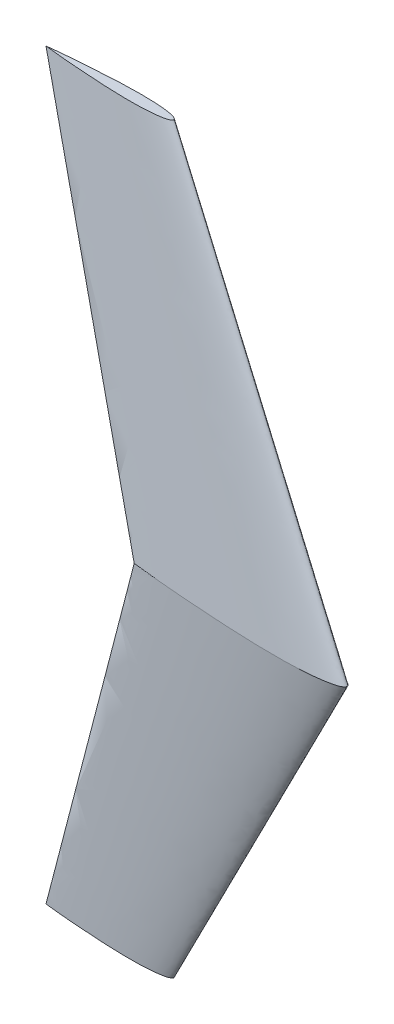
from build123d import *


with BuildPart() as part:
    # Loft1: read off the stored shape, not the designer's step
    # Loft1: loft between two sections, ruled curve by curve
    loft1_from = [
        Edge.make_bspline([(-9121.721523, 10153.4, -888.3073962), (-9121.721523, 10153.4, -888.97481667), (-9089.808343706, 10153.4, -891.630247371), (-9057.07807669, 10153.4, -897.171405393), (-8977.573882293, 10153.4, -905.666450739), (-8879.891657699, 10153.4, -916.211213285), (-8752.61238274, 10153.4, -928.585402678), (-8603.179510828, 10153.4, -942.241130984), (-8432.246847932, 10153.4, -956.914696759), (-8243.391266019, 10153.4, -972.176720475), (-8039.623752093, 10153.4, -987.41758735), (-7824.497301325, 10153.4, -1002.185700126), (-7601.67730037, 10153.4, -1015.801504829), (-7374.97893646, 10153.4, -1027.688394313), (-7148.272960999, 10153.4, -1037.139757469), (-6961.081058327, 10153.4, -1042.599652216), (-6814.239664316, 10153.4, -1045.107889524), (-6707.412896579, 10153.4, -1045.99805137), (-6603.437102019, 10153.4, -1045.873706629), (-6502.756991249, 10153.4, -1044.535259245), (-6405.811536, 10153.4, -1042.185839499), (-6313.023888406, 10153.4, -1038.637706974), (-6224.784017274, 10153.4, -1034.020057375), (-6141.458107161, 10153.4, -1028.225249142), (-6063.399479883, 10153.4, -1021.351335422), (-5990.967621691, 10153.4, -1013.338130748), (-5924.464442276, 10153.4, -1004.338399103), (-5864.149972089, 10153.4, -994.584147276), (-5810.27540371, 10153.4, -984.119063415), (-5763.015750745, 10153.4, -972.979415582), (-5722.594815838, 10153.4, -960.790053577), (-5689.10033376, 10153.4, -947.325206498), (-5662.838775739, 10153.4, -932.4686005), (-5643.953511739, 10153.4, -916.955025127), (-5632.159532765, 10153.4, -902.7362173), (-5626.469170056, 10153.4, -888.3073962), (-5632.159532765, 10153.4, -873.8785751), (-5643.953511739, 10153.4, -859.659767273), (-5662.838775739, 10153.4, -844.1461919), (-5689.10033376, 10153.4, -829.289585902), (-5722.594815838, 10153.4, -815.824738823), (-5763.015750745, 10153.4, -803.635376821), (-5810.275403708, 10153.4, -792.49572897), (-5864.149972109, 10153.4, -782.030645185), (-5924.464442253, 10153.4, -772.276393018), (-5990.967621694, 10153.4, -763.276661476), (-6063.399479882, 10153.4, -755.263456771), (-6141.458107161, 10153.4, -748.38954306), (-6224.784017274, 10153.4, -742.594734825), (-6313.023888406, 10153.4, -737.977085226), (-6405.811536, 10153.4, -734.428952701), (-6502.756991249, 10153.4, -732.079532955), (-6603.437102019, 10153.4, -730.741085571), (-6707.412896579, 10153.4, -730.61674083), (-6814.239664316, 10153.4, -731.506902676), (-6961.081058327, 10153.4, -734.015139984), (-7148.272960999, 10153.4, -739.475034732), (-7374.97893646, 10153.4, -748.926397881), (-7601.677300369, 10153.4, -760.813287392), (-7824.497301335, 10153.4, -774.429091998), (-8039.623752083, 10153.4, -789.197205118), (-8243.39126602, 10153.4, -804.438071909), (-8432.246847932, 10153.4, -819.700095645), (-8603.179510828, 10153.4, -834.373661415), (-8752.61238274, 10153.4, -848.029389722), (-8879.8916577, 10153.4, -860.403579115), (-8977.573882293, 10153.4, -870.948341661), (-9057.07807669, 10153.4, -879.443387007), (-9089.808343706, 10153.4, -884.984545029), (-9121.721523, 10153.4, -887.63997573), (-9121.721523, 10153.4, -888.3073962)], [0, 0, 0, 0, 0.002133427, 0.008488156, 0.018944487, 0.033319114, 0.051356294, 0.072756093, 0.097140817, 0.124097489, 0.153162557, 0.183833918, 0.215589374, 0.247878195, 0.280150868, 0.311860397, 0.327332943, 0.342462846, 0.357187102, 0.371448118, 0.385183441, 0.398331273, 0.410844637, 0.422672607, 0.433769314, 0.444090175, 0.453589412, 0.46224044, 0.470010037, 0.476870985, 0.482833353, 0.487908551, 0.492155164, 0.495592273, 0.498196359, 0.5, 0.501803641, 0.504407727, 0.507844836, 0.512091449, 0.517166647, 0.523129015, 0.529989963, 0.53775956, 0.546410588, 0.555909825, 0.566230686, 0.577327393, 0.589155363, 0.601668727, 0.614816559, 0.628551882, 0.642812898, 0.657537154, 0.672667057, 0.688139603, 0.719849132, 0.752121805, 0.784410626, 0.816166082, 0.846837443, 0.875902511, 0.902859183, 0.927243907, 0.948643706, 0.966680886, 0.981055513, 0.991511844, 0.997866573, 1, 1, 1, 1], 3),
    ]
    loft1_to = [
        Edge.make_bspline([(-5822.7, 0, 0), (-5822.7, 0, -1.112373818), (-5769.511063352, 0, -5.538116989), (-5714.960306037, 0, -14.773433229), (-5582.452556805, 0, -28.931923192), (-5419.647917138, 0, -46.506628046), (-5207.514577802, 0, -67.130395099), (-4958.458365504, 0, -89.890072571), (-4673.568963099, 0, -114.346155525), (-4358.807857992, 0, -139.783007371), (-4019.193390567, 0, -165.184597439), (-3660.647253409, 0, -189.798260212), (-3289.27845915, 0, -212.491397801), (-2911.445689648, 0, -232.302993735), (-2533.600234153, 0, -248.055355828), (-2221.611943654, 0, -257.155232502), (-1976.874885917, 0, -261.335651947), (-1798.829253761, 0, -262.819263517), (-1625.535270768, 0, -262.612021096), (-1457.734125537, 0, -260.381262686), (-1296.157441806, 0, -256.465540692), (-1141.510477173, 0, -250.55195263), (-994.443183366, 0, -242.855825907), (-855.565871478, 0, -233.197756893), (-725.467414568, 0, -221.741168455), (-604.746959832, 0, -208.385750823), (-493.907692905, 0, -193.386112384), (-393.383000524, 0, -177.128932372), (-303.591539157, 0, -159.687026213), (-224.824999969, 0, -141.120840175), (-157.456389456, 0, -120.805120538), (-101.631933081, 0, -98.363580267), (-57.862419144, 0, -73.60242852), (-26.386798956, 0, -47.746321546), (-6.730054803, 0, -24.048172835), (2.753937339, 0, 0), (-6.730054803, 0, 24.048172835), (-26.386798956, 0, 47.746321546), (-57.862419144, 0, 73.60242852), (-101.631933081, 0, 98.363580267), (-157.456389456, 0, 120.805120538), (-224.824999969, 0, 141.120840175), (-303.591539157, 0, 159.687026213), (-393.383000524, 0, 177.128932372), (-493.907692905, 0, 193.386112384), (-604.746959832, 0, 208.385750823), (-725.467414568, 0, 221.741168455), (-855.565871478, 0, 233.197756893), (-994.443183366, 0, 242.855825907), (-1141.510477173, 0, 250.55195263), (-1296.157441806, 0, 256.465540692), (-1457.734125537, 0, 260.381262686), (-1625.535270768, 0, 262.612021096), (-1798.829253761, 0, 262.819263517), (-1976.874885917, 0, 261.335651947), (-2221.611943654, 0, 257.155232502), (-2533.600234153, 0, 248.055355828), (-2911.445689648, 0, 232.302993735), (-3289.27845915, 0, 212.491397801), (-3660.647253409, 0, 189.798260212), (-4019.193390567, 0, 165.184597439), (-4358.807857992, 0, 139.783007371), (-4673.568963099, 0, 114.346155525), (-4958.458365504, 0, 89.890072571), (-5207.514577802, 0, 67.130395099), (-5419.647917138, 0, 46.506628046), (-5582.452556805, 0, 28.931923192), (-5714.960306037, 0, 14.773433229), (-5769.511063352, 0, 5.538116989), (-5822.7, 0, 1.112373818), (-5822.7, 0, 0)], [0, 0, 0, 0, 0.002133427, 0.008488156, 0.018944487, 0.033319114, 0.051356294, 0.072756093, 0.097140817, 0.124097489, 0.153162557, 0.183833918, 0.215589374, 0.247878195, 0.280150868, 0.311860397, 0.327332943, 0.342462846, 0.357187102, 0.371448118, 0.385183441, 0.398331273, 0.410844637, 0.422672607, 0.433769314, 0.444090175, 0.453589412, 0.46224044, 0.470010037, 0.476870985, 0.482833353, 0.487908551, 0.492155164, 0.495592273, 0.498196359, 0.5, 0.501803641, 0.504407727, 0.507844836, 0.512091449, 0.517166647, 0.523129015, 0.529989963, 0.53775956, 0.546410588, 0.555909825, 0.566230686, 0.577327393, 0.589155363, 0.601668727, 0.614816559, 0.628551882, 0.642812898, 0.657537154, 0.672667057, 0.688139603, 0.719849132, 0.752121805, 0.784410626, 0.816166082, 0.846837443, 0.875902511, 0.902859183, 0.927243907, 0.948643706, 0.966680886, 0.981055513, 0.991511844, 0.997866573, 1, 1, 1, 1], 3),
    ]
    loft1 = Solid(Shell([*[Face.make_surface_from_curves(loft1_from[k], loft1_to[k]) for k in range(1)], Face(Wire(loft1_from)), Face(Wire(loft1_to))]))
    add(loft1)

    # Specchia1: Loft1 across plane
    add(loft1.mirror(Plane.ZX))


solid = part.part
